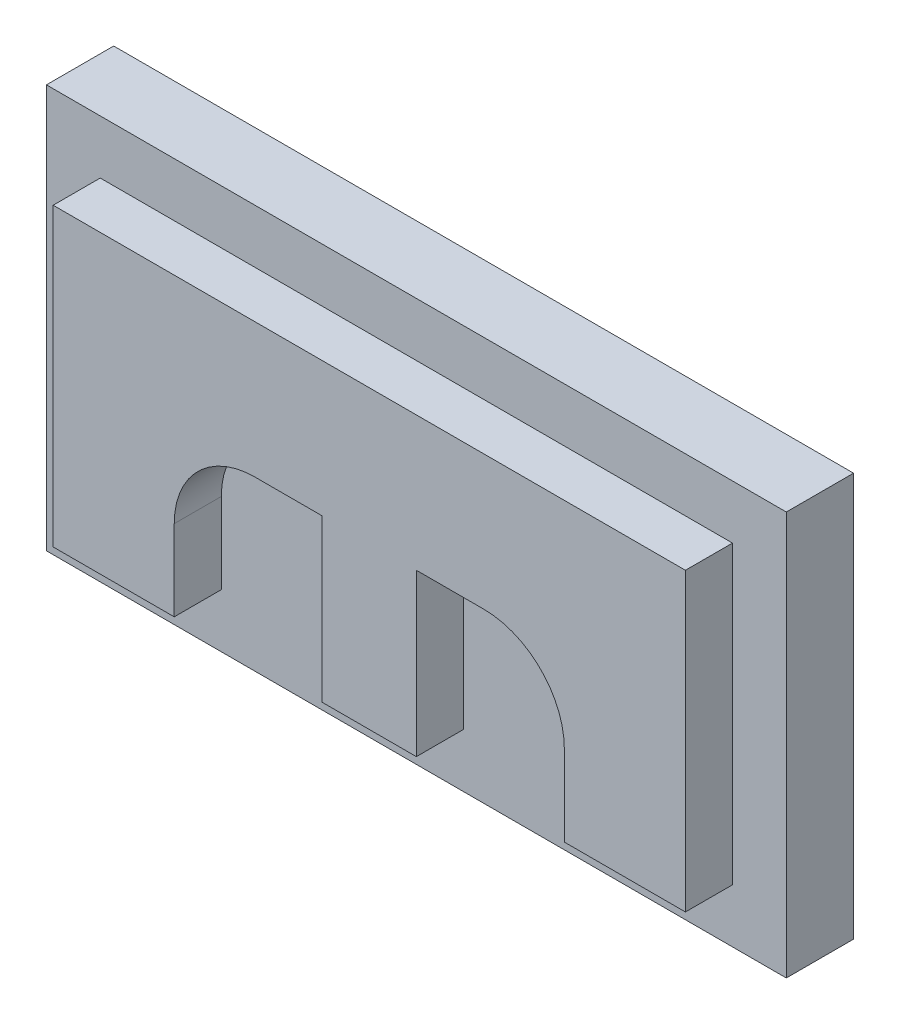
from build123d import *

# Parameters (mm, degrees)
SKETCH1_W            = 110
SKETCH1_H            = 60
BOSS_EXTRUDE1_DEPTH  = 10
SKETCH2_W            = 94
SKETCH2_H            = 44
BOSS_EXTRUDE3_DEPTH  = 7
SKETCH3_W            = 22
SKETCH3_H            = 24
CUT_EXTRUDE1_DEPTH   = 7
FILLET1_R            = 12
FILLET1_OF_MIRROR1_R = 12


with BuildPart() as part:
    # Sketch1 → Boss-Extrude1 (new body)
    with BuildSketch(Plane.XY):
        with Locations((55, 30)):
            Rectangle(SKETCH1_W, SKETCH1_H)
    extrude(amount=BOSS_EXTRUDE1_DEPTH)

    # Sketch2 → Boss-Extrude3 (add)
    with BuildSketch(Plane.XY.offset(10)):
        with Locations((55, 30)):
            Rectangle(SKETCH2_W, SKETCH2_H)
    extrude(amount=BOSS_EXTRUDE3_DEPTH)

    # Sketch3 → Cut-Extrude1 (cut)
    with BuildSketch(Plane.XY.offset(17)):
        with Locations((37, 20)):
            Rectangle(SKETCH3_W, SKETCH3_H)
    cut_extrude1 = extrude(amount=-CUT_EXTRUDE1_DEPTH, mode=Mode.SUBTRACT)

    # Fillet1
    fillet1_edges = [part.edges().sort_by_distance(p)[0] for p in [
        (26, 32, 13.5),
    ]]
    fillet(fillet1_edges, radius=FILLET1_R)

    # Mirror1: Cut-Extrude1 across plane
    add(cut_extrude1.mirror(Plane(origin=(55, 0, 0), x_dir=(0, 0, 1), z_dir=(1, 0, 0))), mode=Mode.SUBTRACT)

    # Fillet1 of Mirror1
    fillet1_of_mirror1_edges = [part.edges().sort_by_distance(p)[0] for p in [
        (84, 32, 13.5),
    ]]
    fillet(fillet1_of_mirror1_edges, radius=FILLET1_OF_MIRROR1_R)


solid = part.part
